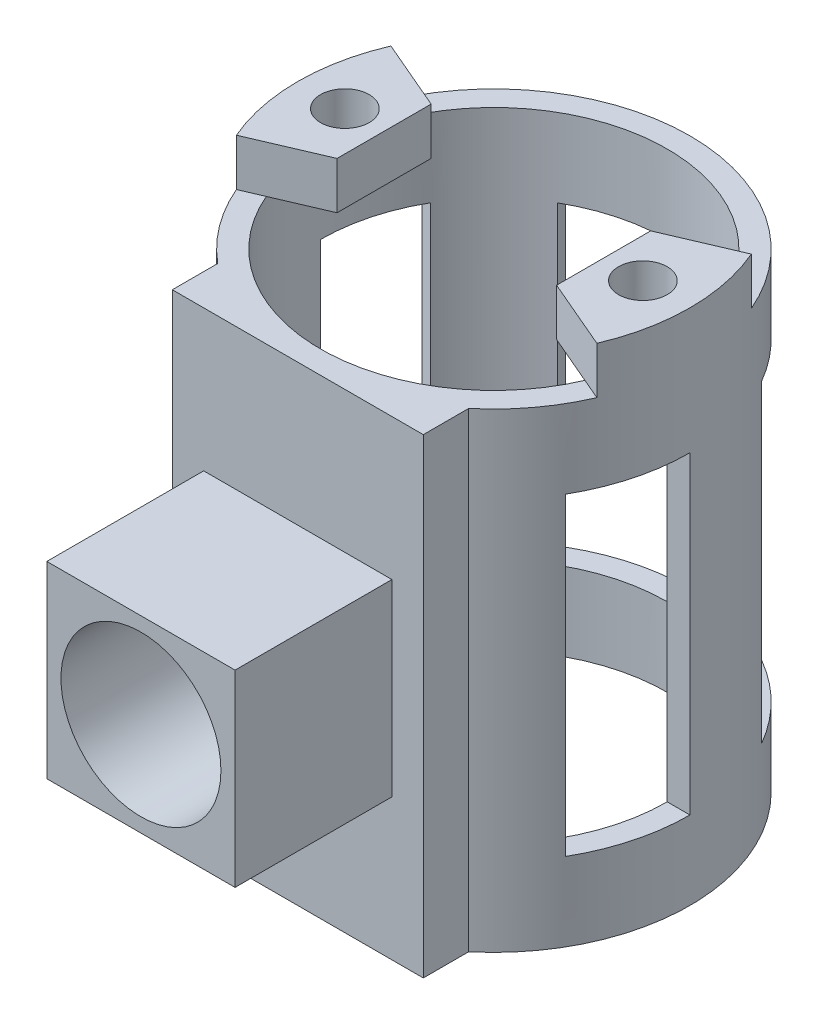
from build123d import *
from build123d.topology import SkipClean

# Parameters (mm, degrees)
SKETCH_1_R      = 12.5
SKETCH_1_R_2    = 11.05
EXTRUDE_1_DEPTH = 5
EXTRUDE_2_DEPTH = 20
SKETCH_3_R      = 12.5
SKETCH_3_R_2    = 11.05
EXTRUDE_3_DEPTH = 5
SKETCH_4_R      = 1.55
EXTRUDE_5_DEPTH = 3
EXTRUDE_START   = -30
EXTRUDE_7_DEPTH = 30
SKETCH_7_W      = 12
SKETCH_7_H      = 12
SKETCH_7_R      = 5.1
EXTRUDE_8_DEPTH = 10


with BuildPart() as part:
    # 草图1 → 凸台-拉伸1 (new body)
    with BuildSketch(Plane(origin=(0, 0, 0), x_dir=(1, 0, 0), z_dir=(0, 1, 0))):
        with Locations(Location((0, 0, 0), (0, 0, 270))):
            Circle(SKETCH_1_R)
        with Locations(Location((0, 0, 0), (0, 0, 270))):
            Circle(SKETCH_1_R_2, mode=Mode.SUBTRACT)
    extrude(amount=EXTRUDE_1_DEPTH)

    # 草图2 → 凸台-拉伸2 (add)
    with SkipClean():  # the faces are left unmerged after this step: merging them gives an invalid solid
        with BuildSketch(Plane(origin=(0, 5, 0), x_dir=(1, 0, 0), z_dir=(0, 1, 0))):
            with BuildLine():
                Line((-10.825318, 6.25), (-9.569581, 5.525))
                ThreePointArc((-9.569581, 5.525), (-7.81353, 7.81353), (-5.525, 9.569581))
                Line((-5.525, 9.569581), (-6.25, 10.825318))
                ThreePointArc((-6.25, 10.825318), (-8.838835, 8.838835), (-10.825318, 6.25))
            make_face()
            with BuildLine():
                Line((0, 12.5), (0, 11.05))
                ThreePointArc((0, 11.05), (2.85995, 10.67348), (5.525, 9.569581))
                Line((5.525, 9.569581), (6.25, 10.825318))
                ThreePointArc((6.25, 10.825318), (3.235238, 12.074073), (0, 12.5))
            make_face()
            with BuildLine():
                Line((10.825318, 6.25), (9.569581, 5.525))
                ThreePointArc((9.569581, 5.525), (10.67348, 2.85995), (11.05, 0))
                Line((11.05, 0), (12.5, 0))
                ThreePointArc((12.5, 0), (12.074073, 3.235238), (10.825318, 6.25))
            make_face()
            with BuildLine():
                Line((10.825318, -6.25), (9.569581, -5.525))
                ThreePointArc((9.569581, -5.525), (7.81353, -7.81353), (5.525, -9.569581))
                Line((5.525, -9.569581), (6.25, -10.825318))
                ThreePointArc((6.25, -10.825318), (8.838835, -8.838835), (10.825318, -6.25))
            make_face()
            with BuildLine():
                Line((0, -12.5), (0, -11.05))
                ThreePointArc((0, -11.05), (-2.85995, -10.67348), (-5.525, -9.569581))
                Line((-5.525, -9.569581), (-6.25, -10.825318))
                ThreePointArc((-6.25, -10.825318), (-3.235238, -12.074073), (0, -12.5))
            make_face()
            with BuildLine():
                Line((-10.825318, -6.25), (-9.569581, -5.525))
                ThreePointArc((-9.569581, -5.525), (-10.67348, -2.85995), (-11.05, 0))
                Line((-11.05, 0), (-12.5, 0))
                ThreePointArc((-12.5, 0), (-12.074073, -3.235238), (-10.825318, -6.25))
            make_face()
        extrude(amount=EXTRUDE_2_DEPTH)

    # 草图3 → 凸台-拉伸3 (add)
    with SkipClean():  # the faces are left unmerged after this step: merging them gives an invalid solid
        with BuildSketch(Plane(origin=(0, 25, 0), x_dir=(1, 0, 0), z_dir=(0, 1, 0))):
            with Locations(Location((0, 0, 0), (0, 0, 270))):
                Circle(SKETCH_3_R)
            with Locations(Location((0, 0, 0), (0, 0, 270))):
                Circle(SKETCH_3_R_2, mode=Mode.SUBTRACT)
        extrude(amount=EXTRUDE_3_DEPTH)

    # 草图4 → 凸台-拉伸5 (add)
    # profile 1 of 2: a face of its own
    with SkipClean():  # the faces are left unmerged after this step: merging them gives an invalid solid
        with BuildSketch(Plane(origin=(0, 30, 0), x_dir=(1, 0, 0), z_dir=(0, 1, 0))):
            with BuildLine():
                Line((-7, -3), (-7, 3))
                Line((-7, 3), (-11.489313, 4.923991))
                ThreePointArc((-11.489313, 4.923991), (-12.5, 0), (-11.489313, -4.923991))
                Line((-11.489313, -4.923991), (-7, -3))
            make_face()
            with Locations(Location((-9.5, 0, 0), (0, 0, 179.999298))):
                Circle(SKETCH_4_R, mode=Mode.SUBTRACT)
        # profile 2 of 2: a face of its own
        with BuildSketch(Plane(origin=(0, 30, 0), x_dir=(1, 0, 0), z_dir=(0, 1, 0))):
            with BuildLine():
                Line((7, -3), (11.489313, -4.923991))
                ThreePointArc((11.489313, -4.923991), (12.5, 0), (11.489313, 4.923991))
                Line((11.489313, 4.923991), (7, 3))
                Line((7, 3), (7, -3))
            make_face()
            with Locations((9.5, 0)):
                Circle(SKETCH_4_R, mode=Mode.SUBTRACT)
        extrude(amount=EXTRUDE_5_DEPTH)

    # 凸台-拉伸7: read off the stored shape, not the designer's step
    # 凸台-拉伸7 outline → 凸台-拉伸7 (add)
    with BuildSketch(Plane(origin=(0, 30, 0), x_dir=(1, 0, 0), z_dir=(0, 1, 0)).offset(EXTRUDE_START)):
        with BuildLine():
            ThreePointArc((-5.525, -9.569581), (-6.321565, -9.06313), (-7.072, -8.490543))
            Line((-7.072, -8.490543), (-8, -9.604686))
            Line((-8, -9.604686), (-8, -12.5))
            Line((-8, -12.5), (0, -12.5))
            ThreePointArc((0, -12.5), (-3.235238, -12.074073), (-6.25, -10.825318))
            Line((-6.25, -10.825318), (-5.525, -9.569581))
        make_face()
        with BuildLine():
            ThreePointArc((5.525, -9.569581), (2.85995, -10.67348), (0, -11.05))
            Line((0, -11.05), (0, -12.5))
            Line((0, -12.5), (8, -12.5))
            Line((8, -12.5), (8, -9.604686))
            ThreePointArc((8, -9.604686), (7.151092, -10.252409), (6.25, -10.825318))
            Line((6.25, -10.825318), (5.525, -9.569581))
        make_face()
    extrude(amount=EXTRUDE_7_DEPTH)

    # 草图7 → 凸台-拉伸8 (add)
    with BuildSketch(Plane.XY.offset(12.5)):
        with Locations((0, 15)):
            Rectangle(SKETCH_7_W, SKETCH_7_H)
        with Locations((0, 15)):
            Circle(SKETCH_7_R, mode=Mode.SUBTRACT)
    extrude(amount=EXTRUDE_8_DEPTH)


solid = part.part
